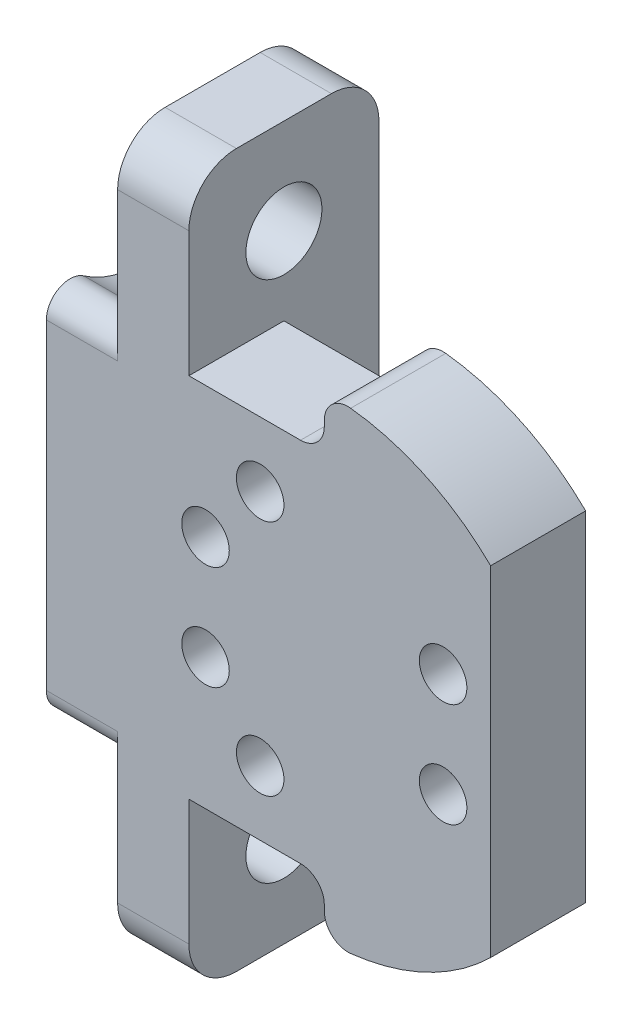
from build123d import *
from build123d.topology import SkipClean

# Parameters (mm, degrees)
BOSS_EXTRUDE1_DEPTH       = 1
BOSS_EXTRUDE1_DEPTH_BACK  = 1
SKETCH1_R                 = 5
SKETCH1_R_2               = 0.5
BOSS_EXTRUDE2_START       = -5.85
BOSS_EXTRUDE2_OUTLINE_W   = 15
BOSS_EXTRUDE2_OUTLINE_H   = 4
BOSS_EXTRUDE2_DEPTH       = 3
BOSS_EXTRUDE2_START_2     = -4
BOSS_EXTRUDE2_2_OUTLINE_R = 0.5
BOSS_EXTRUDE2_2_DEPTH     = 6
CUT_EXTRUDE4_DEPTH        = 8
SKETCH6_R                 = 0.8
CUT_EXTRUDE3_DEPTH        = 9
SKETCH9_W                 = 8
SKETCH9_H                 = 0.25
CUT_EXTRUDE5_DEPTH        = 2
SKETCH10_R                = 2.1
SKETCH10_R_2              = 0.8
CUT_EXTRUDE6_DEPTH        = 1.5
FILLET2_R                 = 1
FILLET3_START             = -5.85
FILLET3_DEPTH             = 1.5
CUT_EXTRUDE2_START        = -10
CUT_EXTRUDE2_DEPTH        = 10
BOSS_EXTRUDE3_START       = -2
BOSS_EXTRUDE3_DEPTH       = 2
FILLET4_R                 = 0.5
CUT_EXTRUDE7_DEPTH        = 1.5


with BuildPart() as part:
    # Sketch1 → Boss-Extrude1 (new, two sides: drawn at the far end of the back side and taken through both)
    with BuildSketch(Plane.XY.offset(-BOSS_EXTRUDE1_DEPTH_BACK)):
        Circle(SKETCH1_R)
        with Locations((-2.5, 1.095)):
            Circle(SKETCH1_R_2, mode=Mode.SUBTRACT)
        with Locations((2.5, 1.095)):
            Circle(SKETCH1_R_2, mode=Mode.SUBTRACT)
        with Locations((-2.5, -1.095)):
            Circle(SKETCH1_R_2, mode=Mode.SUBTRACT)
        with Locations((2.5, -1.095)):
            Circle(SKETCH1_R_2, mode=Mode.SUBTRACT)
        with Locations((-1.35, 2.5)):
            Circle(SKETCH1_R_2, mode=Mode.SUBTRACT)
        with Locations((-1.35, -2.5)):
            Circle(SKETCH1_R_2, mode=Mode.SUBTRACT)
    extrude(amount=BOSS_EXTRUDE1_DEPTH + BOSS_EXTRUDE1_DEPTH_BACK)

    # Boss-Extrude2: read off the stored shape, not the designer's step
    # Boss-Extrude2 outline → Boss-Extrude2 (add)
    with BuildSketch(Plane.YZ.offset(BOSS_EXTRUDE2_START)):
        with Locations((0, -1)):
            Rectangle(BOSS_EXTRUDE2_OUTLINE_W, BOSS_EXTRUDE2_OUTLINE_H)
    extrude(amount=BOSS_EXTRUDE2_DEPTH)

    # Boss-Extrude2 2 outline → Boss-Extrude2 2 (cut)
    with SkipClean():  # the faces are left unmerged after this step: merging them gives an invalid solid
        with BuildSketch(Plane.XY.offset(BOSS_EXTRUDE2_START_2)):
            with Locations((-2.5, 1.095)):
                Circle(BOSS_EXTRUDE2_2_OUTLINE_R)
            with Locations((-2.5, -1.095)):
                Circle(BOSS_EXTRUDE2_2_OUTLINE_R)
        extrude(amount=BOSS_EXTRUDE2_2_DEPTH, mode=Mode.SUBTRACT)

    # Sketch7 → Cut-Extrude4 (cut)
    with SkipClean():  # the faces are left unmerged after this step: merging them gives an invalid solid
        with BuildSketch(Plane(origin=(-2.85, 0, 0), x_dir=(0, 0, -1), z_dir=(1, 0, 0))):
            Polygon((-1, 7.5), (-1, 4.10822346), (1, 4.10822346), (1, 1.452071421), (3, 1.452071421), (3, 7.5), align=None)
            Polygon((-1, -4.10822346), (-1, -7.5), (3, -7.5), (3, -1.452071421), (1, -1.452071421), (1, -4.10822346), align=None)
        extrude(amount=CUT_EXTRUDE4_DEPTH, mode=Mode.SUBTRACT)

    # Sketch6 → Cut-Extrude3 (cut)
    with SkipClean():  # the faces are left unmerged after this step: merging them gives an invalid solid
        with BuildSketch(Plane.ZY.offset(5.85)):
            with Locations(Location((-1, 5.5, 0), (0, 0, 270))):
                Circle(SKETCH6_R)
            with Locations(Location((-1, -5.5, 0), (0, 0, 270))):
                Circle(SKETCH6_R)
        extrude(amount=-CUT_EXTRUDE3_DEPTH, mode=Mode.SUBTRACT)

    # Sketch9 → Cut-Extrude5 (cut)
    with SkipClean():  # the faces are left unmerged after this step: merging them gives an invalid solid
        with BuildSketch(Plane.XY.offset(1)):
            with Locations((1.15, 3.98322346)):
                Rectangle(SKETCH9_W, SKETCH9_H)
            with Locations((1.15, -3.98322346)):
                Rectangle(SKETCH9_W, SKETCH9_H)
        extrude(amount=-CUT_EXTRUDE5_DEPTH, mode=Mode.SUBTRACT)

    # Sketch10 → Cut-Extrude6 (cut)
    # profile 1 of 2: a face of its own
    with SkipClean():  # the faces are left unmerged after this step: merging them gives an invalid solid
        with BuildSketch(Plane.ZY.offset(5.85)):
            with Locations((-1, 5.5)):
                Circle(SKETCH10_R)
            with Locations((-1, 5.5)):
                Circle(SKETCH10_R_2, mode=Mode.SUBTRACT)
        # profile 2 of 2: a face of its own
        with BuildSketch(Plane.ZY.offset(5.85)):
            with Locations((-1, -5.5)):
                Circle(SKETCH10_R)
            with Locations((-1, -5.5)):
                Circle(SKETCH10_R_2, mode=Mode.SUBTRACT)
        extrude(amount=-CUT_EXTRUDE6_DEPTH, mode=Mode.SUBTRACT)

    # Fillet2
    fillet2_edges = [part.edges().sort_by_distance(p)[0] for p in [
        (-4.35, 7.5, -3),
        (-4.35, -7.5, 1),
        (-4.35, -7.5, -3),
        (-4.35, 7.5, 1),
    ]]
    fillet(fillet2_edges, radius=FILLET2_R)

    # Fillet3: read off the stored shape, not the designer's step
    # Fillet3 outline → Fillet3 (cut)
    with SkipClean():  # the faces are left unmerged after this step: merging them gives an invalid solid
        with BuildSketch(Plane.YZ.offset(FILLET3_START)):
            with BuildLine():
                ThreePointArc((-6.696065005, -2.726102113), (-6.574273302, -2.846043449), (-6.5, -3))
                Line((-6.5, -3), (-6.140312424, -3))
                ThreePointArc((-6.140312424, -3), (-6.428345587, -2.883659861), (-6.696065005, -2.726102113))
            make_face()
            with BuildLine():
                ThreePointArc((-7.5, -2), (-7.346043449, -2.074273302), (-7.226102113, -2.196065005))
                ThreePointArc((-7.226102113, -2.196065005), (-7.383659861, -1.928345587), (-7.5, -1.640312424))
                Line((-7.5, -1.640312424), (-7.5, -2))
            make_face()
            with BuildLine():
                ThreePointArc((-3.784723184, -2.211538462), (-4.257978234, -2.693334561), (-4.859687576, -3))
                Line((-4.859687576, -3), (-3.376323942, -3))
                ThreePointArc((-3.376323942, -3), (-3.820300726, -2.729966553), (-3.784723184, -2.211538462))
            make_face()
            with BuildLine():
                Line((-7.5, 0), (-7.5, -0.359687576))
                ThreePointArc((-7.5, -0.359687576), (-7.383659861, -0.071654413), (-7.226102112, 0.196065005))
                ThreePointArc((-7.226102112, 0.196065005), (-7.346043449, 0.074273302), (-7.5, 0))
            make_face()
            with BuildLine():
                ThreePointArc((-4.859687576, 1), (-4.257978234, 0.693334561), (-3.784723184, 0.211538462))
                ThreePointArc((-3.784723184, 0.211538462), (-3.820300726, 0.729966553), (-3.376323942, 1))
                Line((-3.376323942, 1), (-4.859687576, 1))
            make_face()
            with BuildLine():
                ThreePointArc((3.784723184, -2.211538462), (3.820300726, -2.729966553), (3.376323942, -3))
                Line((3.376323942, -3), (4.859687576, -3))
                ThreePointArc((4.859687576, -3), (4.257978234, -2.693334561), (3.784723184, -2.211538462))
            make_face()
            with BuildLine():
                ThreePointArc((-6.5, 1), (-6.574273302, 0.846043449), (-6.696065005, 0.726102113))
                ThreePointArc((-6.696065005, 0.726102113), (-6.428345587, 0.883659861), (-6.140312424, 1))
                Line((-6.140312424, 1), (-6.5, 1))
            make_face()
            with BuildLine():
                Line((4.859687576, 1), (3.376323942, 1))
                ThreePointArc((3.376323942, 1), (3.820300726, 0.729966553), (3.784723184, 0.211538462))
                ThreePointArc((3.784723184, 0.211538462), (4.257978234, 0.693334561), (4.859687576, 1))
            make_face()
            with BuildLine():
                ThreePointArc((6.696065005, -2.726102112), (6.428345587, -2.883659861), (6.140312424, -3))
                Line((6.140312424, -3), (6.5, -3))
                ThreePointArc((6.5, -3), (6.574273302, -2.846043449), (6.696065005, -2.726102112))
            make_face()
            with BuildLine():
                Line((6.5, 1), (6.140312424, 1))
                ThreePointArc((6.140312424, 1), (6.428345587, 0.883659861), (6.696065005, 0.726102112))
                ThreePointArc((6.696065005, 0.726102112), (6.574273302, 0.846043449), (6.5, 1))
            make_face()
            with BuildLine():
                ThreePointArc((7.5, -1.640312424), (7.383659861, -1.928345587), (7.226102112, -2.196065005))
                ThreePointArc((7.226102112, -2.196065005), (7.346043449, -2.074273302), (7.5, -2))
                Line((7.5, -2), (7.5, -1.640312424))
            make_face()
            with BuildLine():
                ThreePointArc((7.5, 0), (7.346043449, 0.074273302), (7.226102113, 0.196065005))
                ThreePointArc((7.226102113, 0.196065005), (7.383659861, -0.071654413), (7.5, -0.359687576))
                Line((7.5, -0.359687576), (7.5, 0))
            make_face()
        extrude(amount=FILLET3_DEPTH, mode=Mode.SUBTRACT)

    # Sketch3 → Cut-Extrude2 (cut)
    with SkipClean():  # the faces are left unmerged after this step: merging them gives an invalid solid
        with BuildSketch(Plane.XY.offset(1).offset(CUT_EXTRUDE2_START)):
            with BuildLine():
                ThreePointArc((3.5, -3.570714214), (5, 0), (3.5, 3.570714214))
                Line((3.5, 3.570714214), (3.5, -3.570714214))
            make_face()
        extrude(amount=CUT_EXTRUDE2_DEPTH, mode=Mode.SUBTRACT)

    # Sketch11 → Boss-Extrude3 (add)
    with SkipClean():  # the faces are left unmerged after this step: merging them gives an invalid solid
        with BuildSketch(Plane.XY.offset(1).offset(BOSS_EXTRUDE3_START)):
            with BuildLine():
                Line((0, -3.85822346), (0, -5))
                ThreePointArc((0, -5), (1.689509204, -4.705906783), (3.180269129, -3.85822346))
                Line((3.180269129, -3.85822346), (0, -3.85822346))
            make_face()
            with BuildLine():
                Line((0, 5), (0, 3.85822346))
                Line((0, 3.85822346), (3.180269129, 3.85822346))
                ThreePointArc((3.180269129, 3.85822346), (1.689509204, 4.705906783), (0, 5))
            make_face()
        extrude(amount=BOSS_EXTRUDE3_DEPTH)

    # Fillet4
    fillet4_edges = [part.edges().sort_by_distance(p)[0] for p in [
        (0, -5, 0),
        (0, -3.85822346, 0),
        (0, 3.85822346, 0),
        (0, 5, 0),
    ]]
    fillet(fillet4_edges, radius=FILLET4_R)

    # Sketch12 → Cut-Extrude7 (cut)
    with BuildSketch(Plane.ZY.offset(5.85)):
        with BuildLine():
            ThreePointArc((1, 6.5), (0.707106781, 7.207106781), (0, 7.5))
            ThreePointArc((0, 7.5), (0.074273302, 7.346043449), (0.196065005, 7.226102113))
            ThreePointArc((0.196065005, 7.226102113), (0.48492424, 6.98492424), (0.726102113, 6.696065005))
            ThreePointArc((0.726102113, 6.696065005), (0.846043449, 6.574273302), (1, 6.5))
        make_face()
        with BuildLine():
            ThreePointArc((-2.726102113, -6.696065005), (-2.48492424, -6.98492424), (-2.196065005, -7.226102113))
            ThreePointArc((-2.196065005, -7.226102113), (-2.074273302, -7.346043449), (-2, -7.5))
            ThreePointArc((-2, -7.5), (-2.707106781, -7.207106781), (-3, -6.5))
            ThreePointArc((-3, -6.5), (-2.846043449, -6.574273302), (-2.726102113, -6.696065005))
        make_face()
        with BuildLine():
            ThreePointArc((0, -7.5), (0.707106781, -7.207106781), (1, -6.5))
            ThreePointArc((1, -6.5), (0.846043449, -6.574273302), (0.726102113, -6.696065005))
            ThreePointArc((0.726102113, -6.696065005), (0.48492424, -6.98492424), (0.196065005, -7.226102113))
            ThreePointArc((0.196065005, -7.226102113), (0.074273302, -7.346043449), (0, -7.5))
        make_face()
        with BuildLine():
            ThreePointArc((-2, 7.5), (-2.707106781, 7.207106781), (-3, 6.5))
            ThreePointArc((-3, 6.5), (-2.846043449, 6.574273302), (-2.726102113, 6.696065005))
            ThreePointArc((-2.726102113, 6.696065005), (-2.48492424, 6.98492424), (-2.196065005, 7.226102113))
            ThreePointArc((-2.196065005, 7.226102113), (-2.074273302, 7.346043449), (-2, 7.5))
        make_face()
    extrude(amount=-CUT_EXTRUDE7_DEPTH, mode=Mode.SUBTRACT)


solid = part.part
